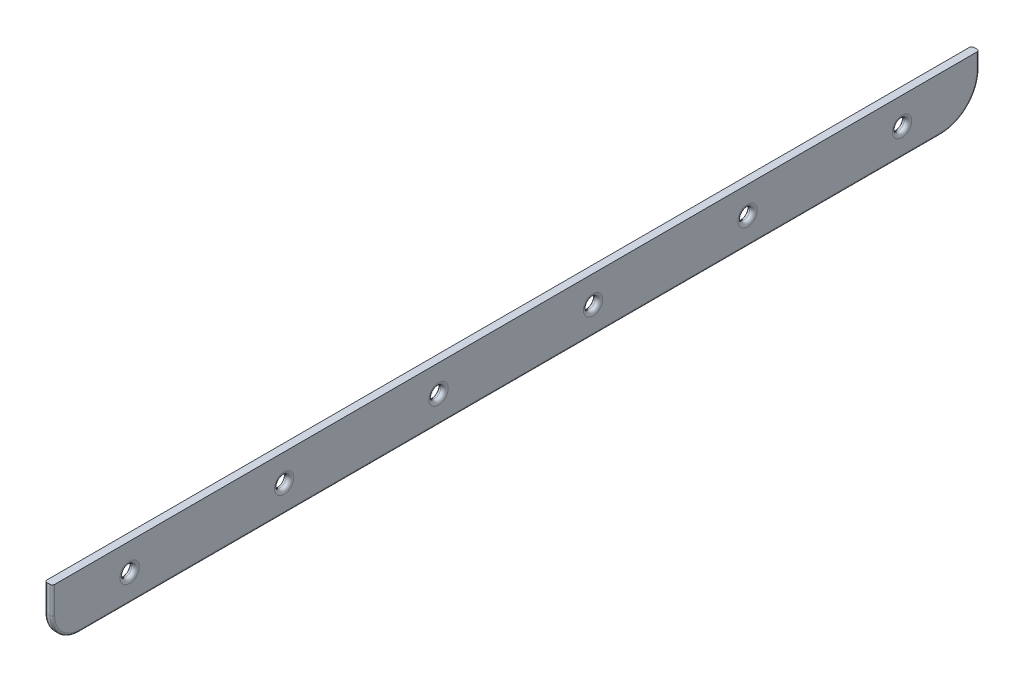
from build123d import *

# Parameters (mm, degrees)
SKETCH1_R           = 7.5
BOSS_EXTRUDE1_DEPTH = 10
FILLET1_R           = 3
FILLET2_R           = 5


with BuildPart() as part:
    # Sketch1 → Boss-Extrude1 (new body)
    with BuildSketch(Plane(origin=(0, 0, 0), x_dir=(0, 0, -1), z_dir=(1, 0, 0))):
        with BuildLine():
            Line((-600, 0), (-600, -35))
            ThreePointArc((-600, -35), (-589.748737342, -59.748737342), (-565, -70))
            Line((-565, -70), (550, -70))
            ThreePointArc((550, -70), (585.355339059, -55.355339059), (600, -20))
            Line((600, -20), (600, 0))
            Line((600, 0), (-600, 0))
        make_face()
        with Locations((-500, -35)):
            Circle(SKETCH1_R, mode=Mode.SUBTRACT)
        with Locations((-300, -35)):
            Circle(SKETCH1_R, mode=Mode.SUBTRACT)
        with Locations((-100, -35)):
            Circle(SKETCH1_R, mode=Mode.SUBTRACT)
        with Locations((100, -35)):
            Circle(SKETCH1_R, mode=Mode.SUBTRACT)
        with Locations((300, -35)):
            Circle(SKETCH1_R, mode=Mode.SUBTRACT)
        with Locations((500, -35)):
            Circle(SKETCH1_R, mode=Mode.SUBTRACT)
    extrude(amount=BOSS_EXTRUDE1_DEPTH)

    # Fillet1
    fillet1_edges = [part.edges().sort_by_distance(p)[0] for p in [
        (10, -59.748737342, 589.748737342),
        (10, -70, 7.5),
        (10, -55.355339059, -585.355339059),
        (10, -10, -600),
        (0, -10, -600),
        (0, -55.355339059, -585.355339059),
        (0, -70, 7.5),
        (0, -59.748737342, 589.748737342),
        (0, -17.5, 600),
        (10, -17.5, 600),
    ]]
    fillet(fillet1_edges, radius=FILLET1_R)

    # Fillet2
    fillet2_edges = [part.edges().sort_by_distance(p)[0] for p in [
        (0, -35, 507.5),
        (10, -35, 507.5),
        (0, -35, 307.5),
        (10, -35, 307.5),
        (0, -35, 107.5),
        (10, -35, 107.5),
        (0, -35, -92.5),
        (10, -35, -92.5),
        (0, -35, -292.5),
        (10, -35, -292.5),
        (0, -35, -492.5),
        (10, -35, -492.5),
    ]]
    fillet(fillet2_edges, radius=FILLET2_R - 0.0001)  # a hair under: the kernel refuses the full size


solid = part.part
